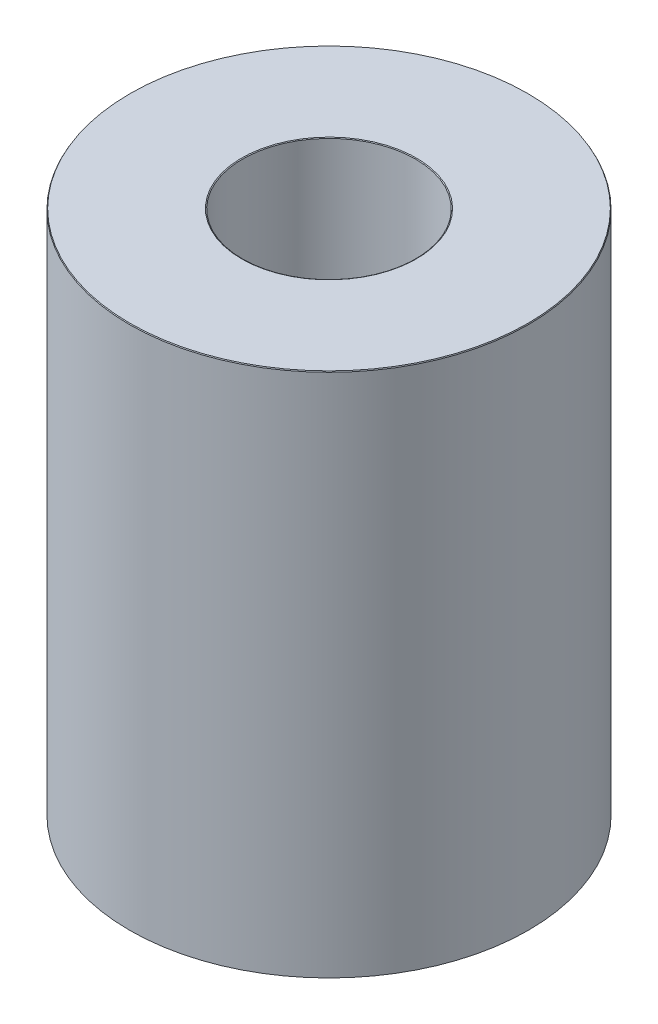
from build123d import *
from OCP.BRepFilletAPI import BRepFilletAPI_MakeChamfer

# Parameters (mm, degrees)
SKETCH1_R           = 52.5
BOSS_EXTRUDE1_DEPTH = 138.423819608
SKETCH2_R           = 22.772078495
CUT_EXTRUDE1_DEPTH  = 158.078495774
CHAMFER1_SIZE       = 0.230836434
CHAMFER1_SIZE2      = 0.133273478


with BuildPart() as part:
    # Sketch1 → Boss-Extrude1 (new body)
    with BuildSketch(Plane(origin=(0, 0, 0), x_dir=(1, 0, 0), z_dir=(0, 1, 0))):
        Circle(SKETCH1_R)
    extrude(amount=BOSS_EXTRUDE1_DEPTH)

    # Sketch2 → Cut-Extrude1 (cut, through all)
    with BuildSketch(Plane(origin=(0, 0, 0), x_dir=(1, 0, 0), z_dir=(0, 1, 0))):
        Circle(SKETCH2_R)
    extrude(amount=CUT_EXTRUDE1_DEPTH, mode=Mode.SUBTRACT)

    # Chamfer1: one chamfer whose edges measure the first distance from different faces: ONE call of the kernel's chamfer builder (chamfer() names one face for all edges)
    chamfer1_edges_1 = [part.edges().sort_by_distance(p)[0] for p in [
        (-22.772078495, 138.423819608, 0),
    ]]
    chamfer1_side_1 = [part.faces().sort_by_distance(p)[0] for p in [
        (-51.01507576, 138.423819608, 0),
    ]]
    chamfer1_edges_2 = [part.edges().sort_by_distance(p)[0] for p in [
        (-22.772078495, 0, 0),
    ]]
    chamfer1_side_2 = [part.faces().sort_by_distance(p)[0] for p in [
        (-22.772078495, 69.211909804, 0),
    ]]
    chamfer1_edges_3 = [part.edges().sort_by_distance(p)[0] for p in [
        (-52.5, 0, 0),
    ]]
    chamfer1_side_3 = [part.faces().sort_by_distance(p)[0] for p in [
        (-51.01507576, 0, 0),
    ]]
    chamfer1_edges_4 = [part.edges().sort_by_distance(p)[0] for p in [
        (-52.5, 138.423819608, 0),
    ]]
    chamfer1_side_4 = [part.faces().sort_by_distance(p)[0] for p in [
        (-52.5, 69.211909804, 0),
    ]]
    chamfer1 = BRepFilletAPI_MakeChamfer(part.part.solid().wrapped)
    for e in chamfer1_edges_1:
        chamfer1.Add(CHAMFER1_SIZE, CHAMFER1_SIZE2, e.wrapped, chamfer1_side_1[0].wrapped)  # the first distance lies on this face
    for e in chamfer1_edges_2:
        chamfer1.Add(CHAMFER1_SIZE, CHAMFER1_SIZE2, e.wrapped, chamfer1_side_2[0].wrapped)  # the first distance lies on this face
    for e in chamfer1_edges_3:
        chamfer1.Add(CHAMFER1_SIZE, CHAMFER1_SIZE2, e.wrapped, chamfer1_side_3[0].wrapped)  # the first distance lies on this face
    for e in chamfer1_edges_4:
        chamfer1.Add(CHAMFER1_SIZE, CHAMFER1_SIZE2, e.wrapped, chamfer1_side_4[0].wrapped)  # the first distance lies on this face
    add(Compound.cast(chamfer1.Shape()), mode=Mode.REPLACE)


solid = part.part
